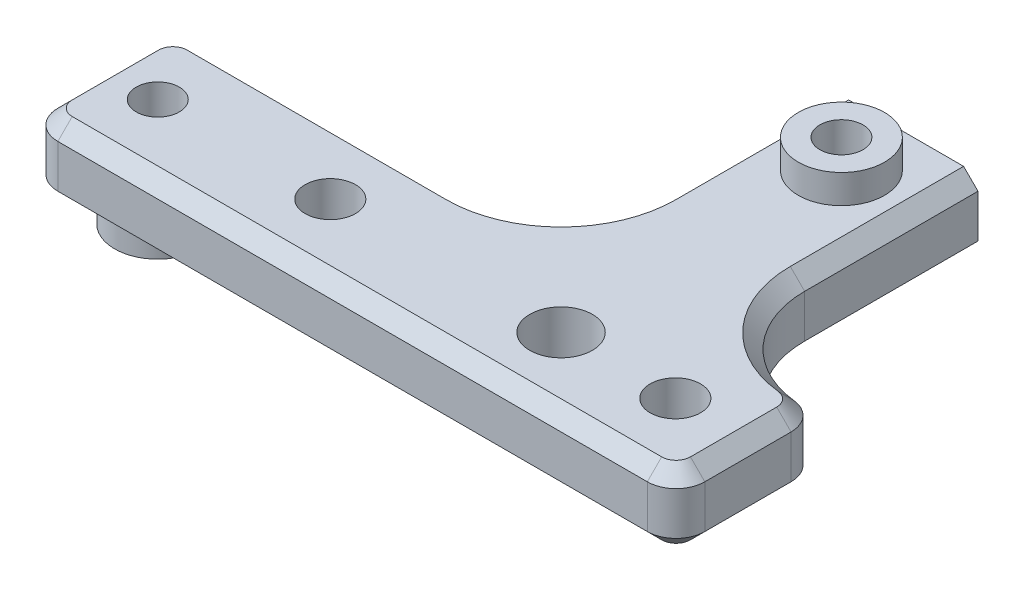
from build123d import *

# Parameters (mm, degrees)
SKETCH1_W           = 45
SKETCH1_H           = 10
BOSS_EXTRUDE1_DEPTH = 5
SKETCH3_R           = 1.5
SKETCH3_R_2         = 2.175
SKETCH3_R_3         = 1.75
CUT_EXTRUDE1_DEPTH  = 7
FILLET1_R           = 2
SKETCH4_R           = 3
SKETCH4_R_2         = 1.5
BOSS_EXTRUDE2_DEPTH = 2.5
SKETCH5_W           = 10
SKETCH5_H           = 5
BOSS_EXTRUDE3_DEPTH = 19
SKETCH6_R           = 1.5
CUT_EXTRUDE2_DEPTH  = 10
BOSS_EXTRUDE4_START = 2
SKETCH7_R           = 3
SKETCH7_R_2         = 1.5
BOSS_EXTRUDE4_DEPTH = 2
FILLET2_R           = 7
CHAMFER1_SIZE       = 1


with BuildPart() as part:
    # Sketch1 → Boss-Extrude1 (new body)
    with BuildSketch(Plane(origin=(0, 0, 0), x_dir=(1, 0, 0), z_dir=(0, 1, 0))):
        Rectangle(SKETCH1_W, SKETCH1_H)
    extrude(amount=BOSS_EXTRUDE1_DEPTH)

    # Sketch3 → Cut-Extrude1 (cut)
    with BuildSketch(Plane(origin=(0, 5, 0), x_dir=(1, 0, 0), z_dir=(0, 1, 0))):
        with Locations(Location((-18.55, 0, 0), (0, 0, 270))):
            Circle(SKETCH3_R)
        with Locations(Location((9.5, 0, 0), (0, 0, 270))):
            Circle(SKETCH3_R_2)
        with Locations(Location((-6.55, 0, 0), (0, 0, 270))):
            Circle(SKETCH3_R_3)
        with Locations(Location((17.45, 0, 0), (0, 0, 270))):
            Circle(SKETCH3_R_3)
    extrude(amount=-CUT_EXTRUDE1_DEPTH, mode=Mode.SUBTRACT)

    # Fillet1
    fillet1_edges = [part.edges().sort_by_distance(p)[0] for p in [
        (22.5, 2.5, 5),
        (-22.5, 2.5, 5),
        (-22.5, 2.5, -5),
        (22.5, 2.5, -5),
    ]]
    fillet(fillet1_edges, radius=FILLET1_R)

    # Sketch4 → Boss-Extrude2 (add)
    with BuildSketch(Plane.XZ):
        with Locations(Location((-18.55, 0, 0), (0, 0, 270))):
            Circle(SKETCH4_R)
        with Locations(Location((-18.55, 0, 0), (0, 0, 90))):
            Circle(SKETCH4_R_2, mode=Mode.SUBTRACT)
    extrude(amount=BOSS_EXTRUDE2_DEPTH)

    # Sketch5 → Boss-Extrude3 (add)
    with BuildSketch(Plane(origin=(0, 0, -5), x_dir=(-1, 0, 0), z_dir=(0, 0, -1))):
        with Locations((-9.5, 2.5)):
            Rectangle(SKETCH5_W, SKETCH5_H)
    extrude(amount=BOSS_EXTRUDE3_DEPTH)

    # Sketch6 → Cut-Extrude2 (cut)
    with BuildSketch(Plane(origin=(0, 5, 0), x_dir=(1, 0, 0), z_dir=(0, 1, 0))):
        with Locations(Location((9.5, 19.5, 0), (0, 0, 270))):
            Circle(SKETCH6_R)
    extrude(amount=-CUT_EXTRUDE2_DEPTH, mode=Mode.SUBTRACT)

    # Sketch7 → Boss-Extrude4 (add)
    with BuildSketch(Plane(origin=(0, 5, 0), x_dir=(1, 0, 0), z_dir=(0, 1, 0)).offset(BOSS_EXTRUDE4_START)):
        with Locations(Location((9.5, 19.5, 0), (0, 0, 270))):
            Circle(SKETCH7_R)
        with Locations(Location((9.5, 19.5, 0), (0, 0, 270))):
            Circle(SKETCH7_R_2, mode=Mode.SUBTRACT)
    extrude(amount=-BOSS_EXTRUDE4_DEPTH)

    # Fillet2
    fillet2_edges = [part.edges().sort_by_distance(p)[0] for p in [
        (4.5, 2.5, -5),
        (14.5, 2.5, -5),
    ]]
    fillet(fillet2_edges, radius=FILLET2_R)

    # Chamfer1
    # the kernel refuses this chamfer: 1 mm, written as the material it takes off along each edge
    with BuildSketch(Plane(origin=(-20.5, 0, -5), x_dir=(0, 1, 0), z_dir=(1, 0, 0))) as chamfer1_piece_1:
        Polygon((CHAMFER1_SIZE, 0), (0, CHAMFER1_SIZE), (0, 0), align=None)
    extrude(amount=18, mode=Mode.SUBTRACT)
    with BuildSketch(Plane(origin=(-20.5, 5, -5), x_dir=(0, -1, 0), z_dir=(1, 0, 0))) as chamfer1_piece_2:
        Polygon((CHAMFER1_SIZE, 0), (0, -CHAMFER1_SIZE), (0, 0), align=None)
    extrude(amount=18, mode=Mode.SUBTRACT)
    with BuildSketch(Plane(origin=(20.5, 0, -3), x_dir=(0.11111111111111072, 0, -0.9938079899999066), z_dir=(-0.9938079899999066, 0, -0.11111111111111072))) as chamfer1_piece_3:
        Polygon((2 - CHAMFER1_SIZE, 0), (2, -CHAMFER1_SIZE), (2, 0), align=None)
    revolve(axis=Axis((20.5, 0, -3), (0, -1, 0)), revolution_arc=83.620629792, mode=Mode.SUBTRACT)
    with BuildSketch(Plane(origin=(-2.5, 5, -12), x_dir=(0, 0, 1), z_dir=(-1, 0, 0))) as chamfer1_piece_4:
        Polygon((7, -CHAMFER1_SIZE), (7 + CHAMFER1_SIZE, 0), (7, 0), align=None)
    revolve(axis=Axis((-2.5, 5, -12), (0, 1, 0)), revolution_arc=90, mode=Mode.SUBTRACT)
    with BuildSketch(Plane(origin=(-2.5, 0, -12), x_dir=(0, 0, 1), z_dir=(-1, 0, 0))) as chamfer1_piece_5:
        Polygon((7 + CHAMFER1_SIZE, 0), (7, CHAMFER1_SIZE), (7, 0), align=None)
    revolve(axis=Axis((-2.5, 0, -12), (0, 1, 0)), revolution_arc=90, mode=Mode.SUBTRACT)
    with BuildSketch(Plane(origin=(21.499999975, 0, -11.944271843), x_dir=(-0.11111110870133047, 0, 0.9938079902693282), z_dir=(0.9938079902693282, 0, 0.11111110870133047))) as chamfer1_piece_6:
        Polygon((6.999999931 + CHAMFER1_SIZE, 0), (6.999999931 + CHAMFER1_SIZE * 6.29164365051e-09, -CHAMFER1_SIZE), (6.999999931, 0), align=None)
    revolve(axis=Axis((21.499999975, 0, -11.944271843), (0, -1, 0)), revolution_arc=83.620630478, mode=Mode.SUBTRACT)
    with BuildSketch(Plane(origin=(21.499999975, 5, -11.944271843), x_dir=(-0.11111110870132958, 0, 0.9938079902693283), z_dir=(0.9938079902693283, 0, 0.11111110870132958))) as chamfer1_piece_7:
        Polygon((6.999999931 + CHAMFER1_SIZE, 0), (6.999999931 + CHAMFER1_SIZE * 6.2916400978e-09, CHAMFER1_SIZE), (6.999999931, 0), align=None)
    revolve(axis=Axis((21.499999975, 5, -11.944271843), (0, -1, 0)), revolution_arc=83.620630478, mode=Mode.SUBTRACT)
    with BuildSketch(Plane(origin=(22.5, 0, -3), x_dir=(-1, 0, 0), z_dir=(0, 0, 1))) as chamfer1_piece_8:
        Polygon((CHAMFER1_SIZE, 0), (0, -CHAMFER1_SIZE), (0, 0), align=None)
    extrude(amount=6, mode=Mode.SUBTRACT)
    with BuildSketch(Plane(origin=(20.5, 0, 5), x_dir=(0, 0, -1), z_dir=(-1, 0, 0))) as chamfer1_piece_9:
        Polygon((CHAMFER1_SIZE, 0), (0, -CHAMFER1_SIZE), (0, 0), align=None)
    extrude(amount=41, mode=Mode.SUBTRACT)
    with BuildSketch(Plane(origin=(-22.5, 0, 3), x_dir=(1, 0, 0), z_dir=(0, 0, -1))) as chamfer1_piece_10_section:
        Polygon((CHAMFER1_SIZE, 0), (0, -CHAMFER1_SIZE), (0, 0), align=None)
    chamfer1_piece_10 = extrude(amount=6, mode=Mode.PRIVATE)
    chamfer1_piece_10 = chamfer1_piece_10 - Plane(origin=(-18.55, 0, 0), x_dir=(0, 0, -1), z_dir=(0, 1, 0)) * Cylinder(3, 16, mode=Mode.PRIVATE)
    add(chamfer1_piece_10, mode=Mode.SUBTRACT)
    with BuildSketch(Plane(origin=(-20.5, 0, 3), x_dir=(-1, 0, 0), z_dir=(0, 0, -1))) as chamfer1_piece_11:
        Polygon((2 - CHAMFER1_SIZE, 0), (2, CHAMFER1_SIZE), (2, 0), align=None)
    revolve(axis=Axis((-20.5, 0, 3), (0, 1, 0)), revolution_arc=90, mode=Mode.SUBTRACT)
    with BuildSketch(Plane(origin=(20.5, 0, 3), x_dir=(1, 0, 0), z_dir=(0, 0, -1))) as chamfer1_piece_12:
        Polygon((2 - CHAMFER1_SIZE, 0), (2, -CHAMFER1_SIZE), (2, 0), align=None)
    revolve(axis=Axis((20.5, 0, 3), (0, -1, 0)), revolution_arc=90, mode=Mode.SUBTRACT)
    with BuildSketch(Plane(origin=(-20.5, 0, -3), x_dir=(0, 0, -1), z_dir=(1, 0, 0))) as chamfer1_piece_13:
        Polygon((2 - CHAMFER1_SIZE, 0), (2, CHAMFER1_SIZE), (2, 0), align=None)
    revolve(axis=Axis((-20.5, 0, -3), (0, 1, 0)), revolution_arc=90, mode=Mode.SUBTRACT)
    with BuildSketch(Plane(origin=(22.5, 5, -3), x_dir=(-1, 0, 0), z_dir=(0, 0, 1)), Plane(origin=(-22.5, 5, 3), x_dir=(1, 0, 0), z_dir=(0, 0, -1))) as chamfer1_piece_14:
        Polygon((CHAMFER1_SIZE, 0), (0, CHAMFER1_SIZE), (0, 0), align=None)
    extrude(amount=6, mode=Mode.SUBTRACT)
    with BuildSketch(Plane(origin=(20.5, 5, 5), x_dir=(0, 0, -1), z_dir=(-1, 0, 0))) as chamfer1_piece_15:
        Polygon((CHAMFER1_SIZE, 0), (0, CHAMFER1_SIZE), (0, 0), align=None)
    extrude(amount=41, mode=Mode.SUBTRACT)
    with BuildSketch(Plane(origin=(-20.5, 5, 3), x_dir=(-1, 0, 0), z_dir=(0, 0, -1))) as chamfer1_piece_16:
        Polygon((2 - CHAMFER1_SIZE, 0), (2, -CHAMFER1_SIZE), (2, 0), align=None)
    revolve(axis=Axis((-20.5, 5, 3), (0, 1, 0)), revolution_arc=90, mode=Mode.SUBTRACT)
    with BuildSketch(Plane(origin=(20.5, 5, 3), x_dir=(1, 0, 0), z_dir=(0, 0, -1))) as chamfer1_piece_17:
        Polygon((2 - CHAMFER1_SIZE, 0), (2, CHAMFER1_SIZE), (2, 0), align=None)
    revolve(axis=Axis((20.5, 5, 3), (0, -1, 0)), revolution_arc=90, mode=Mode.SUBTRACT)
    with BuildSketch(Plane(origin=(-20.5, 5, -3), x_dir=(0, 0, -1), z_dir=(1, 0, 0))) as chamfer1_piece_18:
        Polygon((2, -CHAMFER1_SIZE), (2 - CHAMFER1_SIZE, 0), (2, 0), align=None)
    revolve(axis=Axis((-20.5, 5, -3), (0, 1, 0)), revolution_arc=90, mode=Mode.SUBTRACT)
    with BuildSketch(Plane(origin=(20.5, 5, -3), x_dir=(0.11111111111111072, 0, -0.9938079899999066), z_dir=(-0.9938079899999066, 0, -0.11111111111111072))) as chamfer1_piece_19:
        Polygon((2 - CHAMFER1_SIZE, 0), (2, CHAMFER1_SIZE), (2, 0), align=None)
    revolve(axis=Axis((20.5, 5, -3), (0, -1, 0)), revolution_arc=83.620629792, mode=Mode.SUBTRACT)
    with BuildSketch(Plane(origin=(14.5, 5, -11.94427191), x_dir=(-1, 0, 0), z_dir=(0, 0, -1))) as chamfer1_piece_20:
        Polygon((CHAMFER1_SIZE, 0), (0, -CHAMFER1_SIZE), (0, 0), align=None)
    extrude(amount=14.627411078, mode=Mode.SUBTRACT)
    with BuildSketch(Plane(origin=(14.5, 0, -11.94427191), x_dir=(-1, 0, 0), z_dir=(0, 0, -1))) as chamfer1_piece_21:
        Polygon((CHAMFER1_SIZE, 0), (0, CHAMFER1_SIZE), (0, 0), align=None)
    extrude(amount=14.627411078, mode=Mode.SUBTRACT)
    with BuildSketch(Plane(origin=(4.5, 0, -12), x_dir=(1, 0, 0), z_dir=(0, 0, -1))) as chamfer1_piece_22:
        Polygon((CHAMFER1_SIZE, 0), (0, -CHAMFER1_SIZE), (0, 0), align=None)
    extrude(amount=14.571682988, mode=Mode.SUBTRACT)
    with BuildSketch(Plane(origin=(4.5, 5, -12), x_dir=(1, 0, 0), z_dir=(0, 0, -1))) as chamfer1_piece_23:
        Polygon((CHAMFER1_SIZE, 0), (0, CHAMFER1_SIZE), (0, 0), align=None)
    extrude(amount=14.571682988, mode=Mode.SUBTRACT)


solid = part.part
